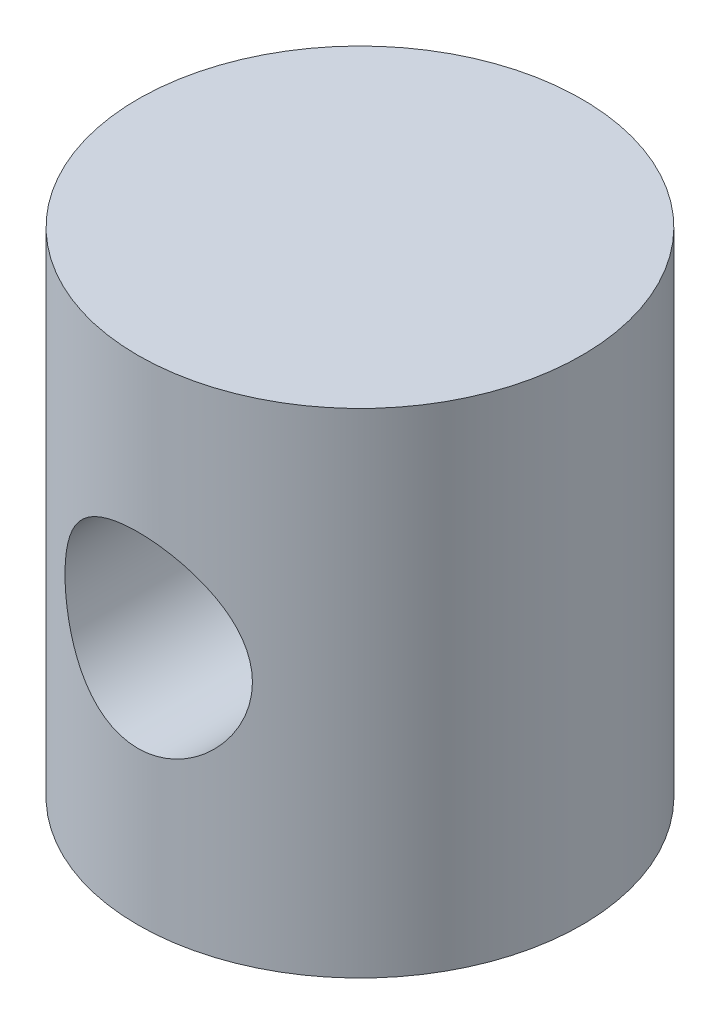
from build123d import *

# Parameters (mm, degrees)
SKETCH3_R               = 4.5
BOSS_EXTRUDE1_DEPTH     = 10
CUT_EXTRUDE1_DEPTH      = 12.853269591
CUT_EXTRUDE1_DEPTH_BACK = 12.853269591
SKETCH5_R               = 1.9


with BuildPart() as part:
    # Sketch3 → Boss-Extrude1 (new body)
    with BuildSketch(Plane(origin=(0, 0, 0), x_dir=(1, 0, 0), z_dir=(0, 1, 0))):
        Circle(SKETCH3_R)
    extrude(amount=BOSS_EXTRUDE1_DEPTH)

    # Sketch5 → Cut-Extrude1 (cut, two sides: drawn at the far end of the back side and taken through both)
    with BuildSketch(Plane.XY.offset(-CUT_EXTRUDE1_DEPTH_BACK)):
        with Locations((0, 5)):
            Circle(SKETCH5_R)
    extrude(amount=CUT_EXTRUDE1_DEPTH + CUT_EXTRUDE1_DEPTH_BACK, mode=Mode.SUBTRACT)


solid = part.part
